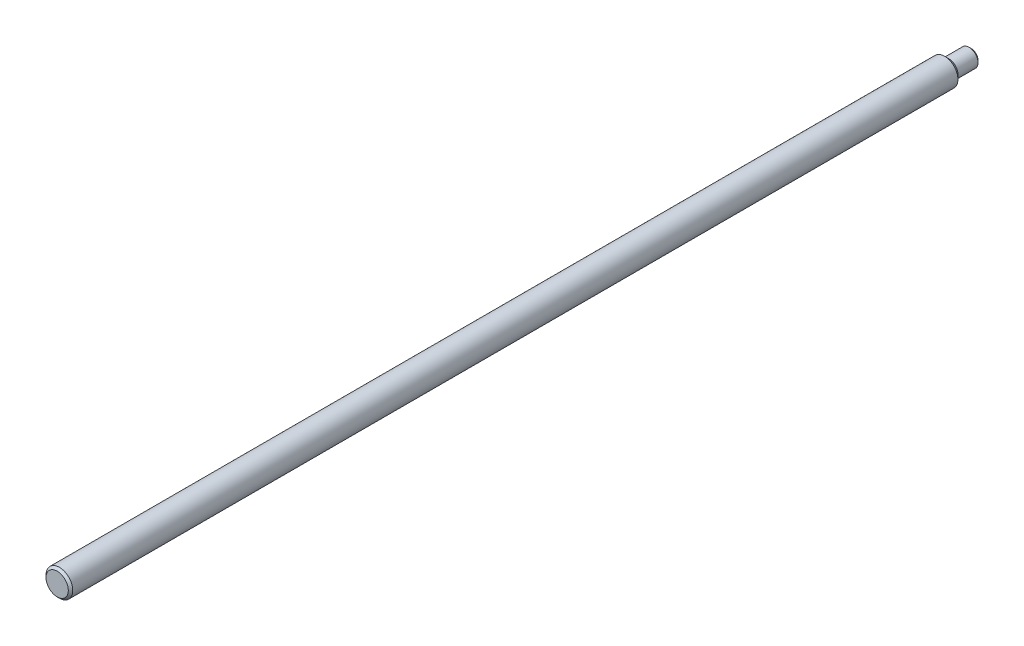
from build123d import *

# Parameters (mm, degrees)
SCHIZZO1_R                   = 6
ESTRUSIONE_ESTRUSIONE1_DEPTH = 410
SMUSSO1_SIZE                 = 1


with BuildPart() as part:
    # Schizzo1 → Estrusione-Estrusione1 (new body)
    with BuildSketch(Plane.XY):
        Circle(SCHIZZO1_R)
    extrude(amount=ESTRUSIONE_ESTRUSIONE1_DEPTH)

    # Schizzo2 → Taglia-Rivoluzione1 (revolve, cut)
    with BuildSketch(Plane(origin=(0, 0, 0), x_dir=(1, 0, 0), z_dir=(0, 1, 0))):
        Polygon((-4, -10), (-6, -12), (-6, 0), (-4, 0), align=None)
    revolve(axis=Axis((0, 0, -1.898721367), (0, 0, 1)), mode=Mode.SUBTRACT)

    # Smusso1
    smusso1_edges = [part.edges().sort_by_distance(p)[0] for p in [
        (4, 0, 0),
        (-6, 0, 410),
    ]]
    chamfer(smusso1_edges, length=SMUSSO1_SIZE)


solid = part.part
